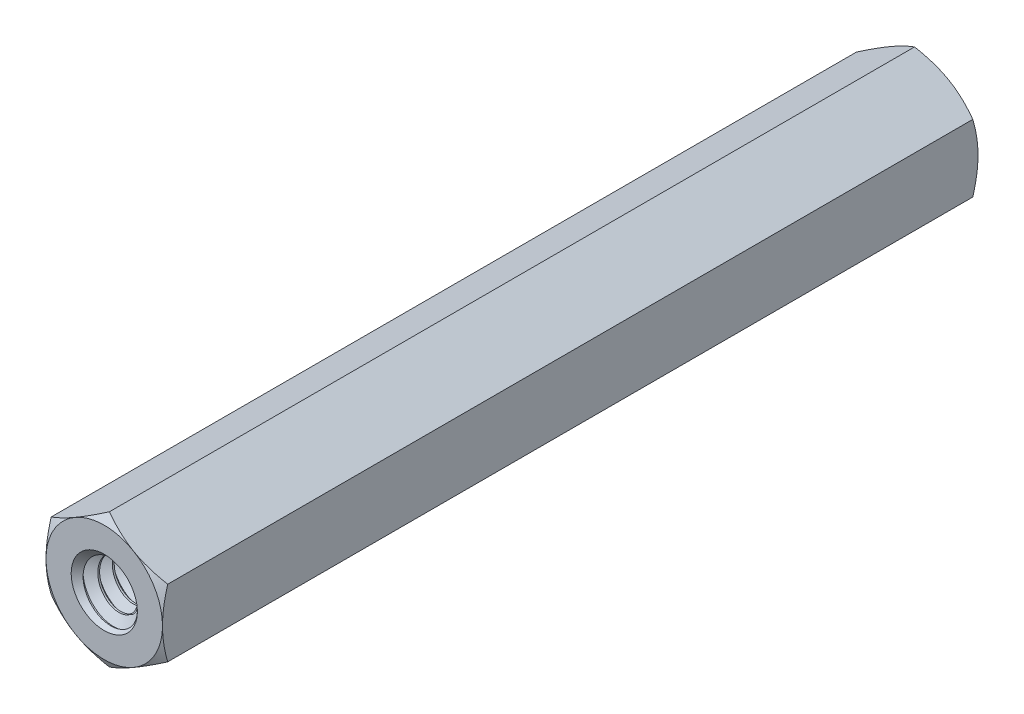
from build123d import *

# Parameters (mm, degrees)
EXTRUDE1_DEPTH          = 22.225
EXTRUDE1_DEPTH_BACK     = 22.225
SKETCH1_R               = 1.7526
SWEEP1_PITCH            = 0.79375
EXTRUDE2_DEPTH          = 46.503121384
SKETCH8_OUTSIDE_W       = 178.696
SKETCH8_OUTSIDE_H       = 179.678
SKETCH8_OUTSIDE_R       = 3.175
EXTRUDE4_DEPTH          = 46.503121384
EXTRUDE4_DRAFT          = -60
MIRROR1_COPY_1_SKETCH_W = 178.696
MIRROR1_COPY_1_SKETCH_H = 179.678
MIRROR1_COPY_1_SKETCH_R = 3.175
MIRROR1_COPY_1_DEPTH    = 46.503121384
MIRROR1_COPY_1_DRAFT    = -60
SKETCH9_W               = 25.4
SKETCH9_H               = 1.8034


with BuildPart() as part:
    # Sketch1 → Extrude1 (new, two sides: drawn at the far end of the back side and taken through both)
    with BuildSketch(Plane.XY.offset(-EXTRUDE1_DEPTH_BACK)):
        Polygon((0, 3.666174209), (-3.175, 1.833087105), (-3.175, -1.833087105), (0, -3.666174209), (3.175, -1.833087105), (3.175, 1.833087105), align=None)
        Circle(SKETCH1_R, mode=Mode.SUBTRACT)
    extrude(amount=EXTRUDE1_DEPTH + EXTRUDE1_DEPTH_BACK)

    # Sweep1: the profile of Sketch12 profile screwed along a right-hand helix of 57 turns, 6 arcs to a turn; built about Z, then put on its axis
    sweep1_z = Axis((0, 0, 0), (0, 0, 1))
    sweep1_corners = [(1.7529, 0, -0.694704455), (1.7529, 0, 0.000173205), (1.237044252, 0, -0.29765625), (1.237044252, 0, -0.396875)]
    with BuildLine(mode=Mode.PRIVATE) as sweep1_profile:
        Line(sweep1_corners[0], sweep1_corners[1])
        Line(sweep1_corners[1], sweep1_corners[2])
        Line(sweep1_corners[2], sweep1_corners[3])
        Line(sweep1_corners[3], sweep1_corners[0])
    sweep1_cap = Face(sweep1_profile.wire())
    sweep1_turn_angles = [0, 30, 60, 90, 120, 150, 180, 210, 240, 270, 300, 330, 360, 390, 420, 450, 480, 510, 540, 570, 600, 630, 660, 690, 720]
    sweep1_turn_weights = [1, 0.8660254037844387, 1, 0.8660254037844387, 1, 0.8660254037844387, 1, 0.8660254037844387, 1, 0.8660254037844387, 1, 0.8660254037844387, 1, 0.8660254037844387, 1, 0.8660254037844387, 1, 0.8660254037844387, 1, 0.8660254037844387, 1, 0.8660254037844387, 1, 0.8660254037844387, 1]
    sweep1_turn_rails = [Edge.make_bspline([Vector(p[0], p[1], 0).rotate(sweep1_z, sweep1_turn_angles[k]) / sweep1_turn_weights[k] + Vector(0, 0, p[2] + SWEEP1_PITCH * sweep1_turn_angles[k] / 360) for k in range(25)], [0, 0, 0, 1, 1, 2, 2, 3, 3, 4, 4, 5, 5, 6, 6, 7, 7, 8, 8, 9, 9, 10, 10, 11, 11, 12, 12, 12], 2, sweep1_turn_weights) for p in sweep1_corners]
    sweep1_turn_sides = [Face.make_surface_from_curves(sweep1_turn_rails[p[0]], sweep1_turn_rails[p[1]]) for p in [(0, 1), (1, 2), (2, 3), (3, 0)]]
    sweep1_last_angles = [20160, 20190, 20220, 20250, 20280, 20310, 20340, 20370, 20400, 20430, 20460, 20490, 20519.999999999]
    sweep1_last_weights = [1, 0.8660254037844387, 1, 0.8660254037844387, 1, 0.8660254037844387, 1, 0.8660254037844387, 1, 0.8660254037844387, 1, 0.8660254037873752, 1]
    sweep1_last_rails = [Edge.make_bspline([Vector(p[0], p[1], 0).rotate(sweep1_z, sweep1_last_angles[k]) / sweep1_last_weights[k] + Vector(0, 0, p[2] + SWEEP1_PITCH * sweep1_last_angles[k] / 360) for k in range(13)], [0, 0, 0, 1, 1, 2, 2, 3, 3, 4, 4, 5, 5, 6, 6, 6], 2, sweep1_last_weights) for p in sweep1_corners]
    sweep1_last_sides = [Face.make_surface_from_curves(sweep1_last_rails[p[0]], sweep1_last_rails[p[1]]) for p in [(0, 1), (1, 2), (2, 3), (3, 0)]]
    sweep1 = Plane(origin=(0, 0, -22.225), x_dir=(0, 1, 0), z_dir=(0, 0, 1)) * Solid(Shell([*[p.moved(Location((0, 0, 2 * SWEEP1_PITCH * i))) for i in range(28) for p in sweep1_turn_sides], *sweep1_last_sides, sweep1_cap, sweep1_cap.rotate(sweep1_z, 20519.999999999).moved(Location((0, 0, SWEEP1_PITCH * 20519.999999999 / 360)))]))
    add(sweep1)

    # Sketch6 → Extrude2 (cut, through all)
    with BuildSketch(Plane(origin=(0, 0, -22.225), x_dir=(-1, 0, 0), z_dir=(0, 0, -1))):
        Polygon((0, 3.666174209), (-3.175, 1.833087105), (-3.175, -1.833087105), (0, -3.666174209), (3.175, -1.833087105), (3.175, 1.833087105), align=None)
    extrude2 = extrude(amount=EXTRUDE2_DEPTH, mode=Mode.SUBTRACT)

    # Extrude3 cone 1 section (through the dimple's axis) → Extrude3 (revolve, cut)
    with BuildSketch(Plane(origin=(0, 0, -22.225), x_dir=(0, 1, 0), z_dir=(1, 0, 0))):
        Polygon((0, 0), (1.8034, 0), (0, 1.933909732), align=None)
    extrude3 = revolve(axis=Axis((0, 0, -22.225), (0, 0, 1)), mode=Mode.SUBTRACT)


with BuildPart() as extrude4_tool:
    # Sketch8 outside → Extrude4 (with draft: the straight prism first)
    with BuildSketch(Plane(origin=(0, 0, -22.225), x_dir=(-1, 0, 0), z_dir=(0, 0, -1))):
        Rectangle(SKETCH8_OUTSIDE_W, SKETCH8_OUTSIDE_H)
        Circle(SKETCH8_OUTSIDE_R, mode=Mode.SUBTRACT)
    extrude(amount=-EXTRUDE4_DEPTH)
    # Extrude4: the draft: its side faces are tilted about the plane it starts from
    extrude4_sides = [extrude4_tool.faces().sort_by_distance(p)[0] for p in [
        (0, -89.839, 1.026560692),
        (-89.348, 0, 1.026560692),
        (0, 89.839, 1.026560692),
        (89.348, 0, 1.026560692),
        (3.175, 0, 1.026560692),
    ]]
    draft(extrude4_sides, Plane(origin=(0, 0, -22.225), x_dir=(-1, 0, 0), z_dir=(0, 0, -1)), EXTRUDE4_DRAFT)


with BuildPart() as part_1:
    add(part.part)

    # Extrude4: cut by extrude4_tool
    add(extrude4_tool.part, mode=Mode.SUBTRACT)

    # Mirror1: Extrude2, Extrude3 across plane
    add(extrude2.mirror(Plane.XY), mode=Mode.SUBTRACT)
    add(extrude3.mirror(Plane.XY), mode=Mode.SUBTRACT)


with BuildPart() as mirror1_copy_1_tool:
    # Mirror1 copy 1 sketch → Mirror1 copy 1 (with draft: the straight prism first)
    with BuildSketch(Plane(origin=(0, 0, 22.225), x_dir=(-1, 0, 0), z_dir=(0, 0, 1))):
        Rectangle(MIRROR1_COPY_1_SKETCH_W, MIRROR1_COPY_1_SKETCH_H)
        Circle(MIRROR1_COPY_1_SKETCH_R, mode=Mode.SUBTRACT)
    extrude(amount=-MIRROR1_COPY_1_DEPTH)
    # Mirror1 copy 1: the draft: its side faces are tilted about the plane it starts from
    mirror1_copy_1_sides = [mirror1_copy_1_tool.faces().sort_by_distance(p)[0] for p in [
        (0, -89.839, -1.026560692),
        (-89.348, 0, -1.026560692),
        (0, 89.839, -1.026560692),
        (89.348, 0, -1.026560692),
        (3.175, 0, -1.026560692),
    ]]
    draft(mirror1_copy_1_sides, Plane(origin=(0, 0, 22.225), x_dir=(-1, 0, 0), z_dir=(0, 0, 1)), MIRROR1_COPY_1_DRAFT)


with BuildPart() as part_2:
    add(part_1.part)

    # Mirror1 copy 1: cut by mirror1_copy_1_tool
    add(mirror1_copy_1_tool.part, mode=Mode.SUBTRACT)

    # Sketch9 → Revolve 2 (revolve)
    with BuildSketch(Plane(origin=(0, 0, 0), x_dir=(0, 0, -1), z_dir=(1, 0, 0)), mode=Mode.PRIVATE) as revolve_2_sk:
        with Locations((0, 0.9017)):
            Rectangle(SKETCH9_W, SKETCH9_H)
    revolve(revolve_2_sk.sketch.rotate(Axis((0, 0, 22.225), (0, 0, -1)), 270), axis=Axis((0, 0, 22.225), (0, 0, -1)))


solid = part_2.part
